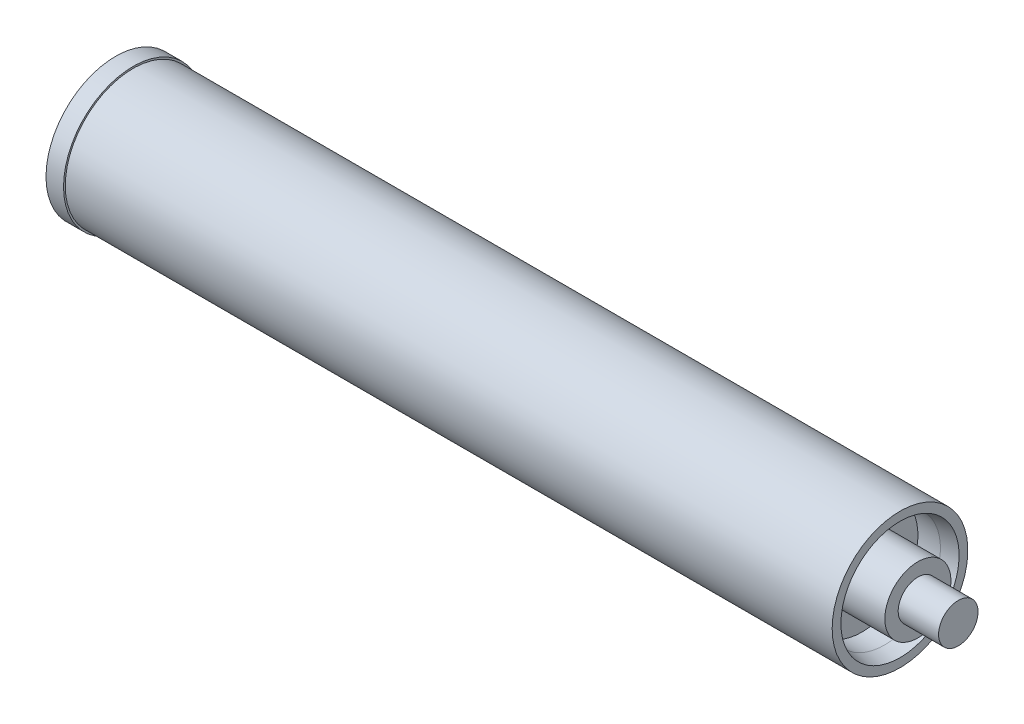
from build123d import *


with BuildPart() as part:
    # Esquisse2 → Révolution7 (revolve)
    with BuildSketch(Plane.XY):
        Polygon((0, 26), (12.7, 26), (36.56741584, 26), (36.56741584, 35.689138439), (25.4, 35.689138439), (12.7, 38.2095), (12.7, 50.419), (25.4, 50.419), (25.4, 49.149), (581.02, 49.149), (581.02, 42.820187711), (569.69714835, 40.573126289), (553.411969834, 40.573126289), (553.411969834, 23.9395), (593.98, 23.9395), (593.98, 14.2875), (623.27, 14.2875), (623.27, 0), (0, 0), align=None)
    revolve(axis=Axis((0, 0, 0), (1, 0, 0)))

    # Esquisse3 → Enlèvement de matière-Révolution1 (revolve, cut)
    with BuildSketch(Plane.XY):
        Polygon((0, 20), (0, 0), (390.090795287, 0), (553.411969834, 12.957757221), (381.061065959, 12.957757221), (381.061065959, 44.271024873), (65.871878934, 44.271024873), (34.08300614, 14.327580407), (19.08300614, 14.327580407), align=None)
    revolve(axis=Axis((0, 0, 0), (1, 0, 0)), mode=Mode.SUBTRACT)


solid = part.part
